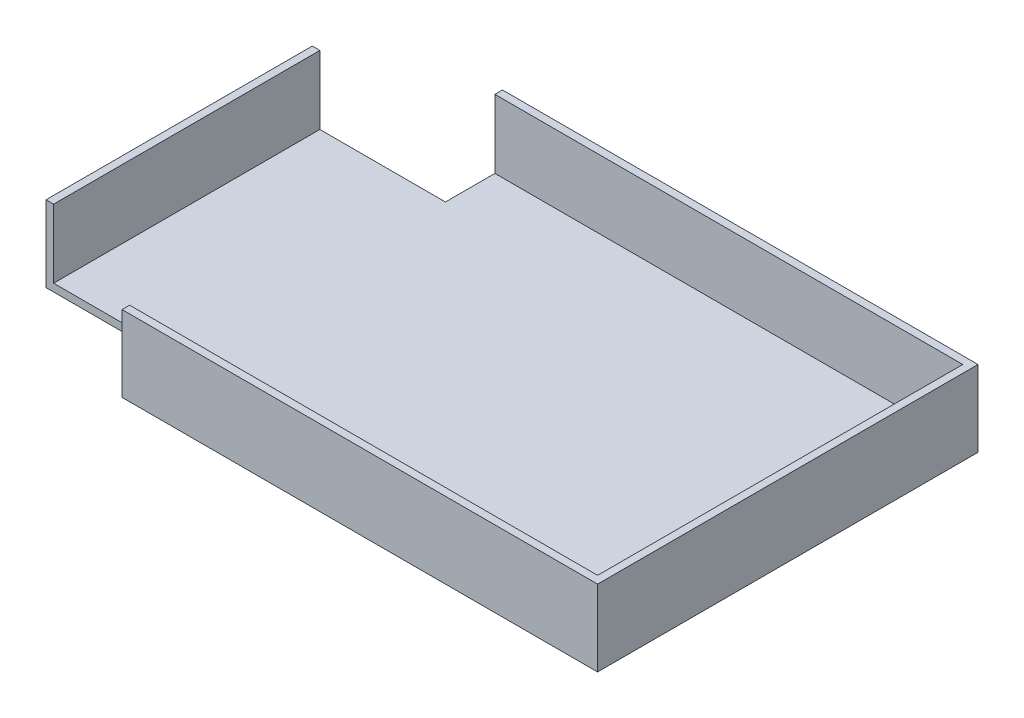
from build123d import *

# Parameters (mm, degrees)
BOSS_EXTRUDE1_DEPTH = 25.4
SKETCH2_W           = 198.12
SKETCH2_H           = 121.92
CUT_EXTRUDE1_DEPTH  = 22.86


with BuildPart() as part:
    # Sketch1 → Boss-Extrude1 (new body)
    with BuildSketch(Plane(origin=(0, 0, 0), x_dir=(1, 0, 0), z_dir=(0, 1, 0))):
        Polygon((-101.6, 44.45), (-57.15, 44.45), (-57.15, 63.5), (101.6, 63.5), (101.6, -63.5), (-57.15, -63.5), (-57.15, -44.45), (-101.6, -44.45), align=None)
    extrude(amount=BOSS_EXTRUDE1_DEPTH)

    # Sketch2 → Cut-Extrude1 (cut)
    with BuildSketch(Plane(origin=(0, 25.4, 0), x_dir=(1, 0, 0), z_dir=(0, 1, 0))):
        Rectangle(SKETCH2_W, SKETCH2_H)
    extrude(amount=-CUT_EXTRUDE1_DEPTH, mode=Mode.SUBTRACT)


solid = part.part
